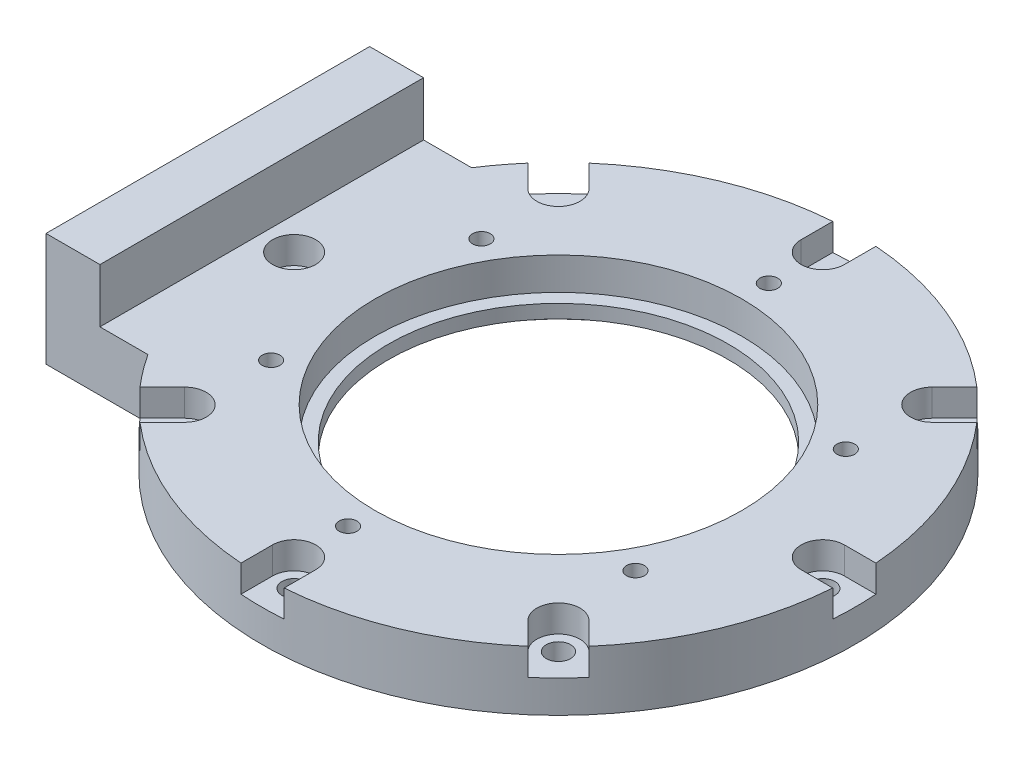
from build123d import *
from build123d.topology import SkipClean

# Parameters (mm, degrees)
SKETCH_1_R                   = 35
EXTRUDE_1_DEPTH              = 2.5
SKETCH_2_R                   = 31.5
EXTRUDE_2_DEPTH              = 2.5
SKETCH_3_R                   = 34
EXTRUDE_3_DEPTH              = 6
HOLE_WIZARD_M4_1_D           = 4.5
HOLE_WIZARD_M4_1_CBORE_D     = 8
HOLE_WIZARD_M4_1_CBORE_DEPTH = 5
HOLE_WIZARD_M4_1_2_D         = 3.3
PATTERN_CIRCULAR_1_COUNT     = 8
PATTERN_CIRCULAR_2_COUNT     = 6
SKETCH_11_W                  = 8
SKETCH_11_H                  = 12
CUT_EXTRUDE_1_DEPTH          = 5
SKETCH_12_W                  = 10
SKETCH_12_H                  = 60
EXTRUDE_4_DEPTH              = 10
SKETCH_13_W                  = 200
SKETCH_13_H                  = 130
CUT_EXTRUDE_2_DEPTH          = 86.854528128
PATTERN_CIRCULAR_3_COUNT     = 8


with BuildPart() as part:
    # 스케치1 → 보스-돌출1 (new body)
    with BuildSketch(Plane(origin=(0, 0, 0), x_dir=(1, 0, 0), z_dir=(0, 1, 0))):
        with BuildLine():
            Line((0, -55), (-65, -55))
            Line((-65, -55), (-65, 55))
            Line((-65, 55), (0, 55))
            ThreePointArc((0, 55), (55, 0), (0, -55))
        make_face()
        Circle(SKETCH_1_R, mode=Mode.SUBTRACT)
    extrude(amount=EXTRUDE_1_DEPTH)

    # 스케치2 → 보스-돌출2 (add)
    with BuildSketch(Plane(origin=(0, 2.5, 0), x_dir=(1, 0, 0), z_dir=(0, 1, 0))):
        with BuildLine():
            Line((-65, 55), (-65, -55))
            Line((-65, -55), (0, -55))
            ThreePointArc((0, -55), (55, 0), (0, 55))
            Line((0, 55), (-65, 55))
        make_face()
        Circle(SKETCH_2_R, mode=Mode.SUBTRACT)
    extrude(amount=EXTRUDE_2_DEPTH)

    # 스케치3 → 보스-돌출3 (add)
    with BuildSketch(Plane(origin=(0, 5, 0), x_dir=(1, 0, 0), z_dir=(0, 1, 0))):
        with BuildLine():
            Line((-65, 55), (-65, -55))
            Line((-65, -55), (0, -55))
            ThreePointArc((0, -55), (55, 0), (0, 55))
            Line((0, 55), (-65, 55))
        make_face()
        Circle(SKETCH_3_R, mode=Mode.SUBTRACT)
    extrude(amount=EXTRUDE_3_DEPTH)

    # Hole Wizard M4 _ _ _ _ _ _1 (through all)
    with Locations(Plane(origin=(0, 11, 0), x_dir=(1, 0, 0), z_dir=(0, 1, 0))):
        with Locations((0, 49)):
            hole_wizard_m4_1 = CounterBoreHole(HOLE_WIZARD_M4_1_D / 2, HOLE_WIZARD_M4_1_CBORE_D / 2, HOLE_WIZARD_M4_1_CBORE_DEPTH)

    # Hole Wizard M4 _ _ _ _1 2 (through all)
    with Locations(Plane(origin=(0, 11, 0), x_dir=(1, 0, 0), z_dir=(0, 1, 0))):
        with Locations((0, 39)):
            hole_wizard_m4_1_2 = Hole(HOLE_WIZARD_M4_1_2_D / 2)

    # 원형 패턴1: Hole Wizard M4 _ _ _ _ _ _1 ×8 about axis
    pattern_circular_1_axis = Axis((0, 2.5, 0), (0, -1, 0))
    for i in range(1, PATTERN_CIRCULAR_1_COUNT):
        add(hole_wizard_m4_1.rotate(pattern_circular_1_axis, i * 360 / PATTERN_CIRCULAR_1_COUNT), mode=Mode.SUBTRACT)

    # 원형 패턴2: Hole Wizard M4 _ _ _ _1 2 ×6 about axis
    pattern_circular_2_axis = Axis((0, 2.5, 0), (0, -1, 0))
    for i in range(1, PATTERN_CIRCULAR_2_COUNT):
        add(hole_wizard_m4_1_2.rotate(pattern_circular_2_axis, i * 360 / PATTERN_CIRCULAR_2_COUNT), mode=Mode.SUBTRACT)

    # 스케치11 → 컷-돌출1 (cut, symmetric)
    with BuildSketch(Plane(origin=(0, 11, 0), x_dir=(1, 0, 0), z_dir=(0, 1, 0))):
        with Locations((0, 55)):
            Rectangle(SKETCH_11_W, SKETCH_11_H)
    cut_extrude_1 = extrude(amount=CUT_EXTRUDE_1_DEPTH, both=True, mode=Mode.SUBTRACT)

    # 스케치12 → 보스-돌출4 (add)
    with BuildSketch(Plane(origin=(0, 11, 0), x_dir=(1, 0, 0), z_dir=(0, 1, 0))):
        with Locations((-60, 0)):
            Rectangle(SKETCH_12_W, SKETCH_12_H)
    extrude(amount=EXTRUDE_4_DEPTH)

    # 스케치13 → 컷-돌출2 (cut, through all)
    with SkipClean():  # the faces are left unmerged after this step: merging them gives an invalid solid
        with BuildSketch(Plane(origin=(0, 11, 0), x_dir=(1, 0, 0), z_dir=(0, 1, 0))):
            Rectangle(SKETCH_13_W, SKETCH_13_H)
            with BuildLine():
                Line((-65, -30), (-46.097722286, -30))
                ThreePointArc((-46.097722286, -30), (55, 0), (-46.097722286, 30))
                Line((-46.097722286, 30), (-65, 30))
                Line((-65, 30), (-65, -30))
            make_face(mode=Mode.SUBTRACT)
        extrude(amount=-CUT_EXTRUDE_2_DEPTH, mode=Mode.SUBTRACT)

    # 원형 패턴3: 컷-돌출1 ×8 about axis, 1 skipped
    with SkipClean():  # the faces are left unmerged after this step: merging them gives an invalid solid
        pattern_circular_3_axis = Axis((0, 2.5, 0), (0, 1, 0))
        add([cut_extrude_1.rotate(pattern_circular_3_axis, i * 360 / PATTERN_CIRCULAR_3_COUNT) for i in range(1, PATTERN_CIRCULAR_3_COUNT) if i not in (2,)], mode=Mode.SUBTRACT)


solid = part.part
